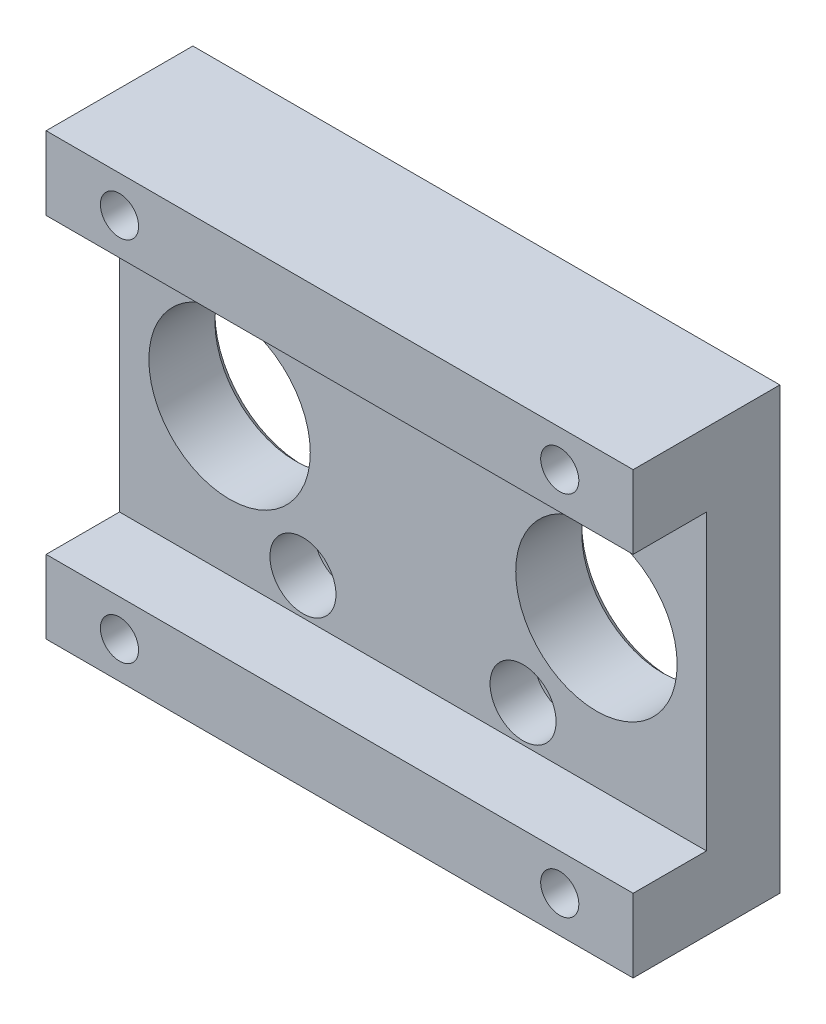
from build123d import *

# Parameters (mm, degrees)
SKIZZE1_W                       = 80
SKIZZE1_H                       = 60
AUFSATZ_LINEAR_AUSTRAGEN1_DEPTH = 10
SKIZZE2_W                       = 80
SKIZZE2_H                       = 10
AUFSATZ_LINEAR_AUSTRAGEN2_DEPTH = 10
SKIZZE5_R                       = 2.6
SCHNITT_LINEAR_AUSTRAGEN3_DEPTH = 20
SKIZZE6_R                       = 11
SCHNITT_LINEAR_AUSTRAGEN4_DEPTH = 12.2
FASE1_SIZE                      = 1
SKIZZE7_R                       = 4.5
SCHNITT_LINEAR_AUSTRAGEN5_DEPTH = 5.3
SKIZZE8_R                       = 2.6
SCHNITT_LINEAR_AUSTRAGEN6_DEPTH = 10
SKIZZE9_R                       = 4.5
SCHNITT_LINEAR_AUSTRAGEN7_DEPTH = 6


with BuildPart() as part:
    # Skizze1 → Aufsatz-Linear austragen1 (new body)
    with BuildSketch(Plane.XY):
        Rectangle(SKIZZE1_W, SKIZZE1_H)
    extrude(amount=AUFSATZ_LINEAR_AUSTRAGEN1_DEPTH)

    # Skizze2 → Aufsatz-Linear austragen2 (add)
    with BuildSketch(Plane.XY.offset(10)):
        with Locations((0, 25)):
            Rectangle(SKIZZE2_W, SKIZZE2_H)
        with Locations((0, -25)):
            Rectangle(SKIZZE2_W, SKIZZE2_H)
    extrude(amount=AUFSATZ_LINEAR_AUSTRAGEN2_DEPTH)

    # Skizze5 → Schnitt-Linear austragen3 (cut)
    with BuildSketch(Plane.XY.offset(20)):
        with Locations((30, 25)):
            Circle(SKIZZE5_R)
        with Locations((-30, 25)):
            Circle(SKIZZE5_R)
        with Locations((-30, -25)):
            Circle(SKIZZE5_R)
        with Locations((30, -25)):
            Circle(SKIZZE5_R)
    extrude(amount=-SCHNITT_LINEAR_AUSTRAGEN3_DEPTH, mode=Mode.SUBTRACT)

    # Skizze6 → Schnitt-Linear austragen4 (cut)
    with BuildSketch(Plane.XY.offset(10)):
        with Locations((-25, 0)):
            Circle(SKIZZE6_R)
        with Locations((25, 0)):
            Circle(SKIZZE6_R)
    extrude(amount=-SCHNITT_LINEAR_AUSTRAGEN4_DEPTH, mode=Mode.SUBTRACT)

    # Fase1
    fase1_edges = [part.edges().sort_by_distance(p)[0] for p in [
        (14, 0, 0),
        (-36, 0, 0),
    ]]
    chamfer(fase1_edges, length=FASE1_SIZE)

    # Skizze7 → Schnitt-Linear austragen5 (cut)
    with BuildSketch(Plane(origin=(0, 0, 0), x_dir=(-1, 0, 0), z_dir=(0, 0, -1))):
        with Locations((-30, 25)):
            Circle(SKIZZE7_R)
        with Locations((30, 25)):
            Circle(SKIZZE7_R)
        with Locations((30, -25)):
            Circle(SKIZZE7_R)
        with Locations((-30, -25)):
            Circle(SKIZZE7_R)
    extrude(amount=-SCHNITT_LINEAR_AUSTRAGEN5_DEPTH, mode=Mode.SUBTRACT)

    # Skizze8 → Schnitt-Linear austragen6 (cut)
    with BuildSketch(Plane(origin=(0, 0, 0), x_dir=(-1, 0, 0), z_dir=(0, 0, -1))):
        with Locations((-15, 15)):
            Circle(SKIZZE8_R)
        with Locations((15, 15)):
            Circle(SKIZZE8_R)
        with Locations((15, -15)):
            Circle(SKIZZE8_R)
        with Locations((-15, -15)):
            Circle(SKIZZE8_R)
    extrude(amount=-SCHNITT_LINEAR_AUSTRAGEN6_DEPTH, mode=Mode.SUBTRACT)

    # Skizze9 → Schnitt-Linear austragen7 (cut)
    with BuildSketch(Plane.XY.offset(10)):
        with Locations((15, 15)):
            Circle(SKIZZE9_R)
        with Locations((-15, 15)):
            Circle(SKIZZE9_R)
        with Locations((-15, -15)):
            Circle(SKIZZE9_R)
        with Locations((15, -15)):
            Circle(SKIZZE9_R)
    extrude(amount=-SCHNITT_LINEAR_AUSTRAGEN7_DEPTH, mode=Mode.SUBTRACT)


solid = part.part
